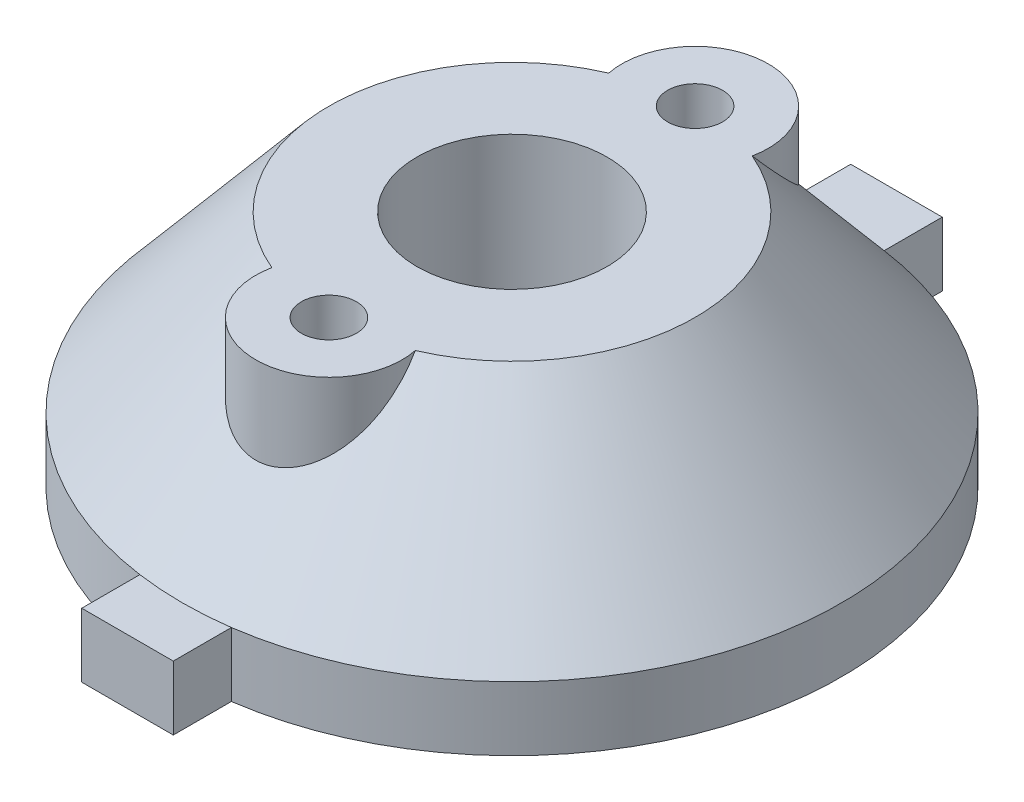
from build123d import *

# Parameters (mm, degrees)
CROQUIS2_R                  = 4
CROQUIS2_R_2                = 1.5
SALIENTE_EXTRUIR1_DEPTH     = 10
CROQUIS3_R                  = 5.192385193
CROQUIS3_R_2                = 1.5
CORTAR_EXTRUIR1_DEPTH       = 8
CROQUIS4_W                  = 5
CROQUIS4_H                  = 42
SALIENTE_EXTRUIR2_DEPTH     = 3.5
SALIENTE_EXTRUIR3_START     = -5
SALIENTE_EXTRUIR3_OUTLINE_R = 1.5
SALIENTE_EXTRUIR3_DEPTH     = 5


# Read off the part's stored shape, not the designer's step: Saliente-Extruir3
with BuildPart() as part:
    # Croquis1 → Revolución1 (revolve)
    with BuildSketch(Plane.XY, mode=Mode.PRIVATE) as revoluci_n1_sk:
        Polygon((0, 0), (18, 0), (18, 3.5), (10, 13), (0, 13), align=None)
    revolve(revoluci_n1_sk.sketch.rotate(Axis((0, 0, 0), (0, 1, 0)), 90), axis=Axis((0, 0, 0), (0, 1, 0)))

    # Croquis2 → Saliente-Extruir1 (add)
    # profile 1 of 2: a face of its own
    with BuildSketch(Plane(origin=(0, 13, 0), x_dir=(1, 0, 0), z_dir=(0, 1, 0))):
        with Locations((0, 10)):
            Circle(CROQUIS2_R)
        with Locations((0, 10)):
            Circle(CROQUIS2_R_2, mode=Mode.SUBTRACT)
    # profile 2 of 2: a face of its own
    with BuildSketch(Plane(origin=(0, 13, 0), x_dir=(1, 0, 0), z_dir=(0, 1, 0))):
        with Locations((0, -10)):
            Circle(CROQUIS2_R)
        with Locations((0, -10)):
            Circle(CROQUIS2_R_2, mode=Mode.SUBTRACT)
    extrude(amount=-SALIENTE_EXTRUIR1_DEPTH)

    # Croquis3 → Cortar-Extruir1 (cut)
    with BuildSketch(Plane(origin=(0, 13, 0), x_dir=(1, 0, 0), z_dir=(0, 1, 0))):
        with Locations(Location((0, 0, 0), (0, 0, 270))):
            Circle(CROQUIS3_R)
        with Locations(Location((0, 10, 0), (0, 0, 270))):
            Circle(CROQUIS3_R_2)
        with Locations(Location((0, -10, 0), (0, 0, 270))):
            Circle(CROQUIS3_R_2)
    extrude(amount=-CORTAR_EXTRUIR1_DEPTH, mode=Mode.SUBTRACT)

    # Croquis4 → Saliente-Extruir2 (add)
    with BuildSketch(Plane.XZ):
        Rectangle(CROQUIS4_W, CROQUIS4_H)
    extrude(amount=-SALIENTE_EXTRUIR2_DEPTH)

    # Saliente-Extruir3 outline → Saliente-Extruir3 (cut)
    with BuildSketch(Plane(origin=(0, 5, 0), x_dir=(1, 0, 0), z_dir=(0, 1, 0)).offset(SALIENTE_EXTRUIR3_START)):
        Circle(SALIENTE_EXTRUIR3_OUTLINE_R)
    extrude(amount=SALIENTE_EXTRUIR3_DEPTH, mode=Mode.SUBTRACT)


solid = part.part
